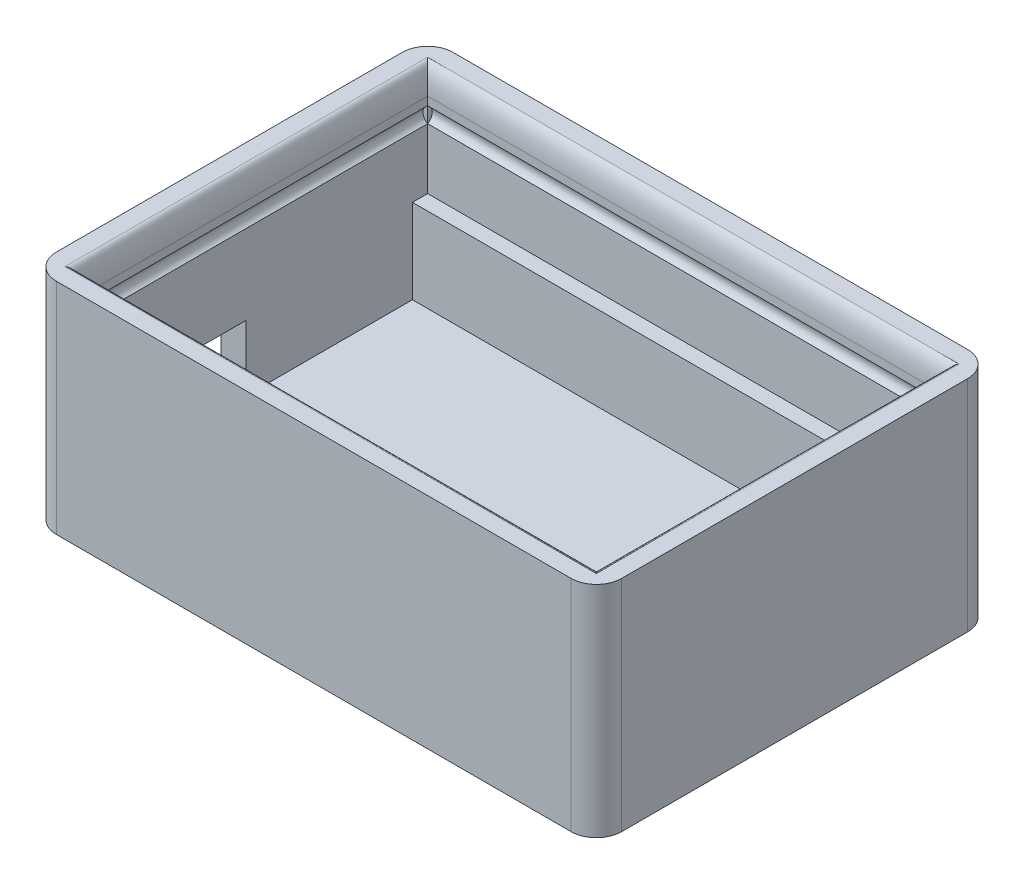
from build123d import *

# Parameters (mm, degrees)
SKETCH1_W           = 61
SKETCH1_H           = 41
BOSS_EXTRUDE1_DEPTH = 23
SHELL1_T            = 3
SKETCH2_W           = 11
SKETCH2_H           = 6.5
CUT_EXTRUDE1_DEPTH  = 72.953109731
SKETCH3_W           = 61
SKETCH3_H           = 1.8
BOSS_EXTRUDE2_DEPTH = 10
SKETCH4_R           = 1.05
CUT_EXTRUDE2_DEPTH  = 41
SKETCH5_R           = 1.05
CUT_EXTRUDE3_DEPTH  = 61
FILLET1_SIZE        = 1
FILLET1_SIZE_2      = 3
FILLET2_R           = 3


with BuildPart() as part:
    # Sketch1 → Boss-Extrude1 (new body)
    with BuildSketch(Plane(origin=(0, 0, 0), x_dir=(1, 0, 0), z_dir=(0, 1, 0))):
        Rectangle(SKETCH1_W, SKETCH1_H)
    extrude(amount=BOSS_EXTRUDE1_DEPTH)

    # Shell1
    shell1_openings = [part.faces().sort_by_distance(p)[0] for p in [
        (0, 23, 0),
    ]]
    offset(amount=SHELL1_T, openings=shell1_openings, kind=Kind.INTERSECTION)

    # Sketch2 → Cut-Extrude1 (cut, through all)
    with BuildSketch(Plane(origin=(-30.5, 0, 0), x_dir=(0, 0, -1), z_dir=(1, 0, 0))):
        with Locations((-6.5, 4.5)):
            Rectangle(SKETCH2_W, SKETCH2_H)
    extrude(amount=-CUT_EXTRUDE1_DEPTH, mode=Mode.SUBTRACT)

    # Sketch3 → Boss-Extrude2 (add)
    with BuildSketch(Plane(origin=(0, 0, 0), x_dir=(1, 0, 0), z_dir=(0, 1, 0))):
        with Locations((0, 19.6)):
            Rectangle(SKETCH3_W, SKETCH3_H)
        with Locations((0, -19.6)):
            Rectangle(SKETCH3_W, SKETCH3_H)
    extrude(amount=BOSS_EXTRUDE2_DEPTH)

    # Sketch4 → Cut-Extrude2 (cut)
    with BuildSketch(Plane.XY.offset(-20.5)):
        with Locations((-30, 18.1)):
            Circle(SKETCH4_R)
        with Locations((30, 18.1)):
            Circle(SKETCH4_R)
    extrude(amount=CUT_EXTRUDE2_DEPTH, mode=Mode.SUBTRACT)

    # Sketch5 → Cut-Extrude3 (cut)
    with BuildSketch(Plane(origin=(-30.5, 0, 0), x_dir=(0, 0, -1), z_dir=(1, 0, 0))):
        with Locations((-20, 18.1)):
            Circle(SKETCH5_R)
        with Locations((20, 18.1)):
            Circle(SKETCH5_R)
    extrude(amount=CUT_EXTRUDE3_DEPTH, mode=Mode.SUBTRACT)

    # Fillet1
    # an asymmetric fillet: 3, 1 mm, written as the material it takes off along each edge
    with BuildSketch(Plane(origin=(30.5, 23, 20.5), x_dir=(0, 0, 1), z_dir=(-1, 0, 0)), Plane(origin=(-30.5, 23, -20.5), x_dir=(0, 0, -1), z_dir=(1, 0, 0))) as fillet1_piece_1:
        with BuildLine():
            Bezier((FILLET1_SIZE, 0), (0, 0), (0, -FILLET1_SIZE_2), weights=[1, 0.707106781, 1])
            Line((0, -FILLET1_SIZE_2), (-0.06, -3))
            Line((-0.06, -3), (-0.06, 0.06))
            Line((-0.06, 0.06), (1, 0.06))
            Line((1, 0.06), (FILLET1_SIZE, 0))
        make_face()
    extrude(amount=61, mode=Mode.SUBTRACT)
    with BuildSketch(Plane(origin=(30.5, 23, -20.5), x_dir=(1, 0, 0), z_dir=(0, 0, 1)), Plane(origin=(-30.5, 23, 20.5), x_dir=(-1, 0, 0), z_dir=(0, 0, -1))) as fillet1_piece_2:
        with BuildLine():
            Bezier((FILLET1_SIZE, 0), (0, 0), (0, -FILLET1_SIZE_2), weights=[1, 0.707106781, 1])
            Line((0, -FILLET1_SIZE_2), (-0.06, -3))
            Line((-0.06, -3), (-0.06, 0.06))
            Line((-0.06, 0.06), (1, 0.06))
            Line((1, 0.06), (FILLET1_SIZE, 0))
        make_face()
    extrude(amount=41, mode=Mode.SUBTRACT)
    with BuildSketch(Plane(origin=(38, 23, 20.5), x_dir=(0, 0, 1), z_dir=(-1, 0, 0))) as fillet1_piece_3a_section:
        with BuildLine():
            Bezier((FILLET1_SIZE, 0), (0, 0), (0, -FILLET1_SIZE_2), weights=[1, 0.707106781, 1])
            Line((0, -FILLET1_SIZE_2), (-0.06, -3))
            Line((-0.06, -3), (-0.06, 0.06))
            Line((-0.06, 0.06), (1, 0.06))
            Line((1, 0.06), (FILLET1_SIZE, 0))
        make_face()
    fillet1_piece_3a = extrude(amount=68.5, mode=Mode.PRIVATE)
    fillet1_piece_3a = split(fillet1_piece_3a, bisect_by=Plane(origin=(30.5, 22.211737764, 20.689651293), z_dir=(1, 0, 0)), keep=Keep.TOP, mode=Mode.PRIVATE)
    with BuildSketch(Plane(origin=(30.5, 23, -20.5), x_dir=(1, 0, 0), z_dir=(0, 0, 1))) as fillet1_piece_3b_section:
        with BuildLine():
            Bezier((FILLET1_SIZE, 0), (0, 0), (0, -FILLET1_SIZE_2), weights=[1, 0.707106781, 1])
            Line((0, -FILLET1_SIZE_2), (-0.06, -3))
            Line((-0.06, -3), (-0.06, 0.06))
            Line((-0.06, 0.06), (1, 0.06))
            Line((1, 0.06), (FILLET1_SIZE, 0))
        make_face()
    fillet1_piece_3b = extrude(amount=48.5, mode=Mode.PRIVATE)
    fillet1_piece_3b = split(fillet1_piece_3b, bisect_by=Plane(origin=(30.689651156, 22.211737177, 20.5), z_dir=(0, 0, 1)), keep=Keep.TOP, mode=Mode.PRIVATE)
    fillet1_piece_3 = fillet1_piece_3a & fillet1_piece_3b
    add(fillet1_piece_3, mode=Mode.SUBTRACT)
    with BuildSketch(Plane(origin=(-30.5, 23, 28), x_dir=(-1, 0, 0), z_dir=(0, 0, -1))) as fillet1_piece_4a_section:
        with BuildLine():
            Bezier((FILLET1_SIZE, 0), (0, 0), (0, -FILLET1_SIZE_2), weights=[1, 0.707106781, 1])
            Line((0, -FILLET1_SIZE_2), (-0.06, -3))
            Line((-0.06, -3), (-0.06, 0.06))
            Line((-0.06, 0.06), (1, 0.06))
            Line((1, 0.06), (FILLET1_SIZE, 0))
        make_face()
    fillet1_piece_4a = extrude(amount=48.5, mode=Mode.PRIVATE)
    fillet1_piece_4a = split(fillet1_piece_4a, bisect_by=Plane(origin=(-30.689651293, 22.211737761, 20.5), z_dir=(0, 0, 1)), keep=Keep.TOP, mode=Mode.PRIVATE)
    with BuildSketch(Plane(origin=(30.5, 23, 20.5), x_dir=(0, 0, 1), z_dir=(-1, 0, 0))) as fillet1_piece_4b_section:
        with BuildLine():
            Bezier((FILLET1_SIZE, 0), (0, 0), (0, -FILLET1_SIZE_2), weights=[1, 0.707106781, 1])
            Line((0, -FILLET1_SIZE_2), (-0.06, -3))
            Line((-0.06, -3), (-0.06, 0.06))
            Line((-0.06, 0.06), (1, 0.06))
            Line((1, 0.06), (FILLET1_SIZE, 0))
        make_face()
    fillet1_piece_4b = extrude(amount=68.5, mode=Mode.PRIVATE)
    fillet1_piece_4b = split(fillet1_piece_4b, bisect_by=Plane(origin=(-30.5, 22.211737179, 20.689651156), z_dir=(-1, 0, 0)), keep=Keep.TOP, mode=Mode.PRIVATE)
    fillet1_piece_4 = fillet1_piece_4a & fillet1_piece_4b
    add(fillet1_piece_4, mode=Mode.SUBTRACT)
    with BuildSketch(Plane(origin=(-30.5, 23, -20.5), x_dir=(0, 0, -1), z_dir=(1, 0, 0))) as fillet1_piece_5a_section:
        with BuildLine():
            Bezier((FILLET1_SIZE, 0), (0, 0), (0, -FILLET1_SIZE_2), weights=[1, 0.707106781, 1])
            Line((0, -FILLET1_SIZE_2), (-0.06, -3))
            Line((-0.06, -3), (-0.06, 0.06))
            Line((-0.06, 0.06), (1, 0.06))
            Line((1, 0.06), (FILLET1_SIZE, 0))
        make_face()
    fillet1_piece_5a = extrude(amount=68.5, mode=Mode.PRIVATE)
    fillet1_piece_5a = split(fillet1_piece_5a, bisect_by=Plane(origin=(30.5, 22.211737179, -20.689651156), z_dir=(1, 0, 0)), keep=Keep.TOP, mode=Mode.PRIVATE)
    with BuildSketch(Plane(origin=(30.5, 23, -28), x_dir=(1, 0, 0), z_dir=(0, 0, 1))) as fillet1_piece_5b_section:
        with BuildLine():
            Bezier((FILLET1_SIZE, 0), (0, 0), (0, -FILLET1_SIZE_2), weights=[1, 0.707106781, 1])
            Line((0, -FILLET1_SIZE_2), (-0.06, -3))
            Line((-0.06, -3), (-0.06, 0.06))
            Line((-0.06, 0.06), (1, 0.06))
            Line((1, 0.06), (FILLET1_SIZE, 0))
        make_face()
    fillet1_piece_5b = extrude(amount=48.5, mode=Mode.PRIVATE)
    fillet1_piece_5b = split(fillet1_piece_5b, bisect_by=Plane(origin=(30.689651293, 22.211737761, -20.5), z_dir=(0, 0, -1)), keep=Keep.TOP, mode=Mode.PRIVATE)
    fillet1_piece_5 = fillet1_piece_5a & fillet1_piece_5b
    add(fillet1_piece_5, mode=Mode.SUBTRACT)
    with BuildSketch(Plane(origin=(-38, 23, -20.5), x_dir=(0, 0, -1), z_dir=(1, 0, 0))) as fillet1_piece_6a_section:
        with BuildLine():
            Bezier((FILLET1_SIZE, 0), (0, 0), (0, -FILLET1_SIZE_2), weights=[1, 0.707106781, 1])
            Line((0, -FILLET1_SIZE_2), (-0.06, -3))
            Line((-0.06, -3), (-0.06, 0.06))
            Line((-0.06, 0.06), (1, 0.06))
            Line((1, 0.06), (FILLET1_SIZE, 0))
        make_face()
    fillet1_piece_6a = extrude(amount=68.5, mode=Mode.PRIVATE)
    fillet1_piece_6a = split(fillet1_piece_6a, bisect_by=Plane(origin=(-30.5, 22.211737764, -20.689651293), z_dir=(-1, 0, 0)), keep=Keep.TOP, mode=Mode.PRIVATE)
    with BuildSketch(Plane(origin=(-30.5, 23, 20.5), x_dir=(-1, 0, 0), z_dir=(0, 0, -1))) as fillet1_piece_6b_section:
        with BuildLine():
            Bezier((FILLET1_SIZE, 0), (0, 0), (0, -FILLET1_SIZE_2), weights=[1, 0.707106781, 1])
            Line((0, -FILLET1_SIZE_2), (-0.06, -3))
            Line((-0.06, -3), (-0.06, 0.06))
            Line((-0.06, 0.06), (1, 0.06))
            Line((1, 0.06), (FILLET1_SIZE, 0))
        make_face()
    fillet1_piece_6b = extrude(amount=48.5, mode=Mode.PRIVATE)
    fillet1_piece_6b = split(fillet1_piece_6b, bisect_by=Plane(origin=(-30.689651156, 22.211737177, -20.5), z_dir=(0, 0, -1)), keep=Keep.TOP, mode=Mode.PRIVATE)
    fillet1_piece_6 = fillet1_piece_6a & fillet1_piece_6b
    add(fillet1_piece_6, mode=Mode.SUBTRACT)

    # Fillet2
    fillet2_edges = [part.edges().sort_by_distance(p)[0] for p in [
        (33.5, 10, 23.5),
        (-33.5, 10, 23.5),
        (-33.5, 10, -23.5),
        (33.5, 10, -23.5),
    ]]
    fillet(fillet2_edges, radius=FILLET2_R)


solid = part.part
